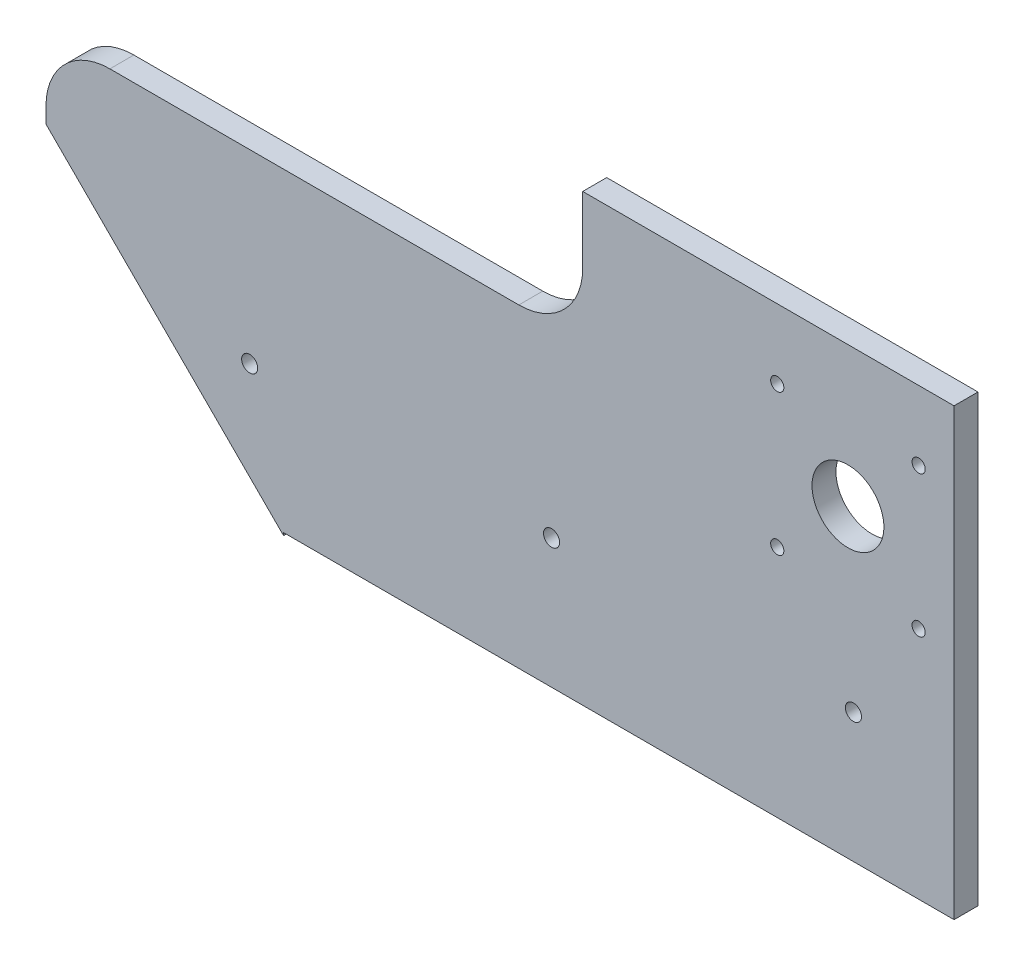
from build123d import *

# Parameters (mm, degrees)
SKETCH1_R                    = 14.2875
BOSS_EXTRUDE1_DEPTH          = 9.525
SKETCH2_W                    = 285.57287806
SKETCH2_H                    = 77.089
CUT_EXTRUDE1_DEPTH           = 267.58430025
SKETCH4_W                    = 213.36
SKETCH4_H                    = 65.465352004
CUT_EXTRUDE2_DEPTH           = 267.58430025
FILLET2_R                    = 25.4
F_6_4_6_4_DIAMETER_HOLE2_D   = 6.4
SKETCH16_W                   = 9.525
SKETCH16_H                   = 0.985363282
CUT_EXTRUDE3_DEPTH           = 390.572219806
SKETCH17_W                   = 147.610011278
SKETCH17_H                   = 12.7
CUT_EXTRUDE4_DEPTH           = 267.045158533
TAP_DRILL_FOR_M6X0_75_TAP1_D = 5.25


with BuildPart() as part:
    # Sketch1 → Boss-Extrude1 (new body)
    with BuildSketch(Plane.XY):
        Polygon((-138.259383474, 48.991487021), (32.210627804, -121.478524257), (222.710627804, -121.478524257), (222.710627804, 146.206839025), (-138.259383474, 146.206839025), align=None)
        with Locations((180.538014078, 76.831975743)):
            Circle(SKETCH1_R, mode=Mode.SUBTRACT)
    extrude(amount=BOSS_EXTRUDE1_DEPTH)

    # Sketch2 → Cut-Extrude1 (cut, through all)
    with BuildSketch(Plane.XY.offset(9.525)):
        with Locations((98.974188774, -82.934024257)):
            Rectangle(SKETCH2_W, SKETCH2_H)
    extrude(amount=-CUT_EXTRUDE1_DEPTH, mode=Mode.SUBTRACT)

    # Sketch4 → Cut-Extrude2 (cut, through all)
    with BuildSketch(Plane.XY.offset(9.525)):
        with Locations((-31.579383474, 113.474163023)):
            Rectangle(SKETCH4_W, SKETCH4_H)
    extrude(amount=-CUT_EXTRUDE2_DEPTH, mode=Mode.SUBTRACT)

    # Fillet2
    fillet2_edges = [part.edges().sort_by_distance(p)[0] for p in [
        (-138.259383474, 80.741487021, 4.7625),
        (75.100616526, 80.741487021, 4.7625),
    ]]
    fillet(fillet2_edges, radius=FILLET2_R)

    # Ø6.4 (6.4) Diameter Hole2 (through all)
    with Locations(Plane(origin=(0, 0, 0), x_dir=(-1, 0, 0), z_dir=(0, 0, -1))):
        with Locations((-182.710627794, 7.042935743), (-62.710627794, 7.042935743), (57.289372206, 7.042935743)):
            Hole(F_6_4_6_4_DIAMETER_HOLE2_D / 2)

    # Sketch16 → Cut-Extrude3 (cut, through all)
    with BuildSketch(Plane(origin=(222.710627804, 0, 0), x_dir=(0, 0, -1), z_dir=(1, 0, 0))):
        with Locations((-4.7625, 145.714157384)):
            Rectangle(SKETCH16_W, SKETCH16_H)
    extrude(amount=-CUT_EXTRUDE3_DEPTH, mode=Mode.SUBTRACT)

    # Sketch17 → Cut-Extrude4 (cut, through all)
    with BuildSketch(Plane(origin=(0, 0, 0), x_dir=(-1, 0, 0), z_dir=(0, 0, -1))):
        with Locations((-148.905622165, 138.871475743)):
            Rectangle(SKETCH17_W, SKETCH17_H)
    extrude(amount=-CUT_EXTRUDE4_DEPTH, mode=Mode.SUBTRACT)

    # Tap Drill for M6x0.75 Tap1 (through all)
    with Locations(Plane.XY.offset(9.525)):
        with Locations((208.638014078, 104.931975743), (152.438014078, 104.931975743), (152.438014078, 48.731975743), (208.638014078, 48.731975743)):
            Hole(TAP_DRILL_FOR_M6X0_75_TAP1_D / 2)


solid = part.part
